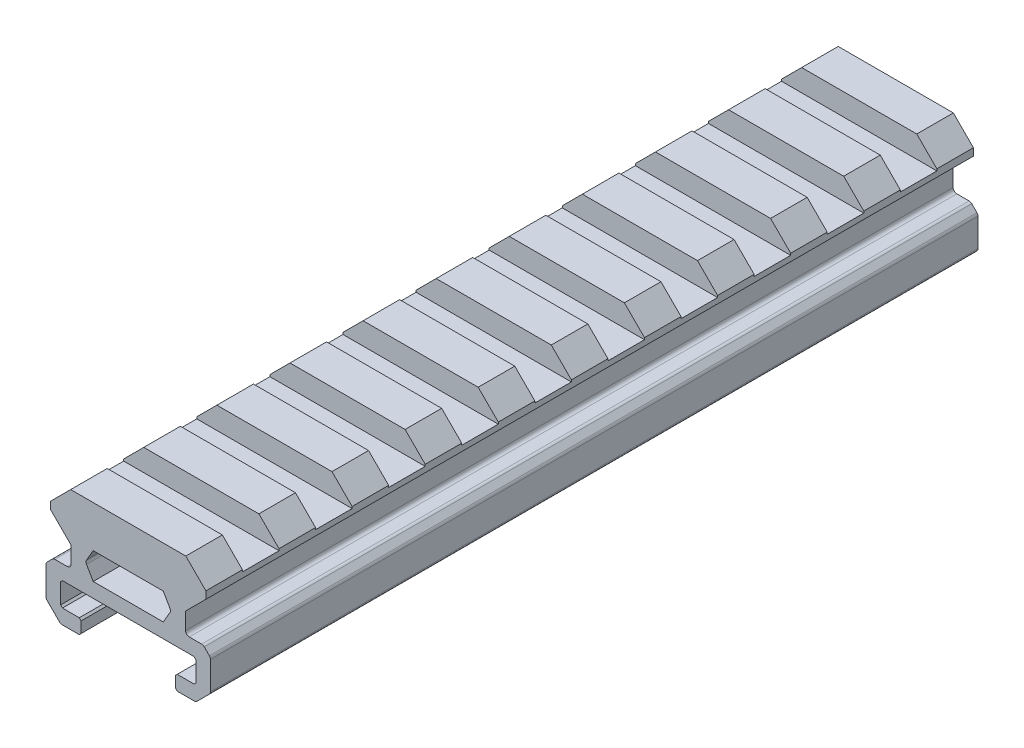
from build123d import *

# Parameters (mm, degrees)
BOSS_EXTRUDE1_DEPTH     = 105
CUT_EXTRUDE1_DEPTH      = 107.209156856
CUT_EXTRUDE1_DEPTH_BACK = 107.209156856
SKETCH2_W               = 5
SKETCH2_H               = 3
CUT_EXTRUDE2_REACH      = 108.209
CHAMFER1_SIZE           = 0.25
FILLET1_R               = 0.5


with BuildPart() as part:
    # Sketch1 → Boss-Extrude1 (new body)
    with BuildSketch(Plane.XY):
        Polygon((7.875, 11.35), (10.625, 8.6), (10.625, 7.6), (7.875, 4.85), (7.85, 4.85), (7.85, 2), (10.25, 2), (11.25, 1), (11.25, -3.25), (9.249999043, -5.25), (6.45, -5.25), (6.45, -3.25), (9.25, -3.25), (9.25, 0), (-9.25, 0), (-9.25, -3.25), (-6.45, -3.25), (-6.45, -5.25), (-9.249999043, -5.25), (-11.25, -3.25), (-11.25, 1), (-10.25, 2), (-7.85, 2), (-7.85, 4.85), (-7.875, 4.85), (-10.625, 7.6), (-10.625, 8.6), (-7.875, 11.35), align=None)
    extrude(amount=BOSS_EXTRUDE1_DEPTH)

    # Sketch2 → Cut-Extrude1 (cut, two sides: drawn at the far end of the back side and taken through both)
    with BuildSketch(Plane(origin=(0, 0, 0), x_dir=(0, 0, -1), z_dir=(1, 0, 0)).offset(-CUT_EXTRUDE1_DEPTH_BACK)):
        with Locations((2.5, 9.85)):
            Rectangle(SKETCH2_W, SKETCH2_H)
        with Locations((-7.5, 9.85)):
            Rectangle(SKETCH2_W, SKETCH2_H)
        with Locations((-17.5, 9.85)):
            Rectangle(SKETCH2_W, SKETCH2_H)
        with Locations((-27.5, 9.85)):
            Rectangle(SKETCH2_W, SKETCH2_H)
        with Locations((-37.5, 9.85)):
            Rectangle(SKETCH2_W, SKETCH2_H)
        with Locations((-47.5, 9.85)):
            Rectangle(SKETCH2_W, SKETCH2_H)
        with Locations((-57.5, 9.85)):
            Rectangle(SKETCH2_W, SKETCH2_H)
        with Locations((-67.5, 9.85)):
            Rectangle(SKETCH2_W, SKETCH2_H)
        with Locations((-77.5, 9.85)):
            Rectangle(SKETCH2_W, SKETCH2_H)
        with Locations((-87.5, 9.85)):
            Rectangle(SKETCH2_W, SKETCH2_H)
        with Locations((-97.5, 9.85)):
            Rectangle(SKETCH2_W, SKETCH2_H)
    extrude(amount=CUT_EXTRUDE1_DEPTH + CUT_EXTRUDE1_DEPTH_BACK, mode=Mode.SUBTRACT)

    # Sketch3 → Cut-Extrude2 (cut, up to next)
    with BuildSketch(Plane.XY, mode=Mode.PRIVATE) as cut_extrude2_sk1:
        Polygon((-5.85, 3.826713562), (-4.795346433, 2), (-2.686039299, 2), (2.686039299, 2), (4.795346433, 2), (5.85, 3.826713562), (4.795346433, 5.653427125), (2.686039299, 5.653427125), (-2.686039299, 5.653427125), (-4.795346433, 5.653427125), align=None)
    cut_extrude2_tool1 = extrude(cut_extrude2_sk1.sketch, amount=CUT_EXTRUDE2_REACH, mode=Mode.PRIVATE) & part.part
    add(cut_extrude2_tool1.solids().sort_by_distance((0, 3.826714, 0))[0], mode=Mode.SUBTRACT)

    # Chamfer1
    chamfer1_edges = [part.edges().sort_by_distance(p)[0] for p in [
        (9.25, 0, 52.5),
        (9.25, -3.25, 52.5),
        (6.45, -3.25, 52.5),
        (6.45, -5.25, 52.5),
        (-9.25, 0, 52.5),
        (-9.25, -3.25, 52.5),
        (-6.45, -3.25, 52.5),
        (-6.45, -5.25, 52.5),
    ]]
    chamfer(chamfer1_edges, length=CHAMFER1_SIZE)

    # Fillet1
    fillet1_edges = [part.edges().sort_by_distance(p)[0] for p in [
        (-9.249999043, -5.25, 52.5),
        (-11.25, -3.25, 52.5),
        (9.249999043, -5.25, 52.5),
        (11.25, -3.25, 52.5),
        (11.25, 1, 52.5),
        (10.25, 2, 52.5),
        (-11.25, 1, 52.5),
        (-10.25, 2, 52.5),
        (-7.85, 2, 52.5),
        (7.85, 2, 52.5),
        (5.85, 3.826713562, 52.5),
        (-5.85, 3.826713562, 52.5),
    ]]
    fillet(fillet1_edges, radius=FILLET1_R)


solid = part.part
